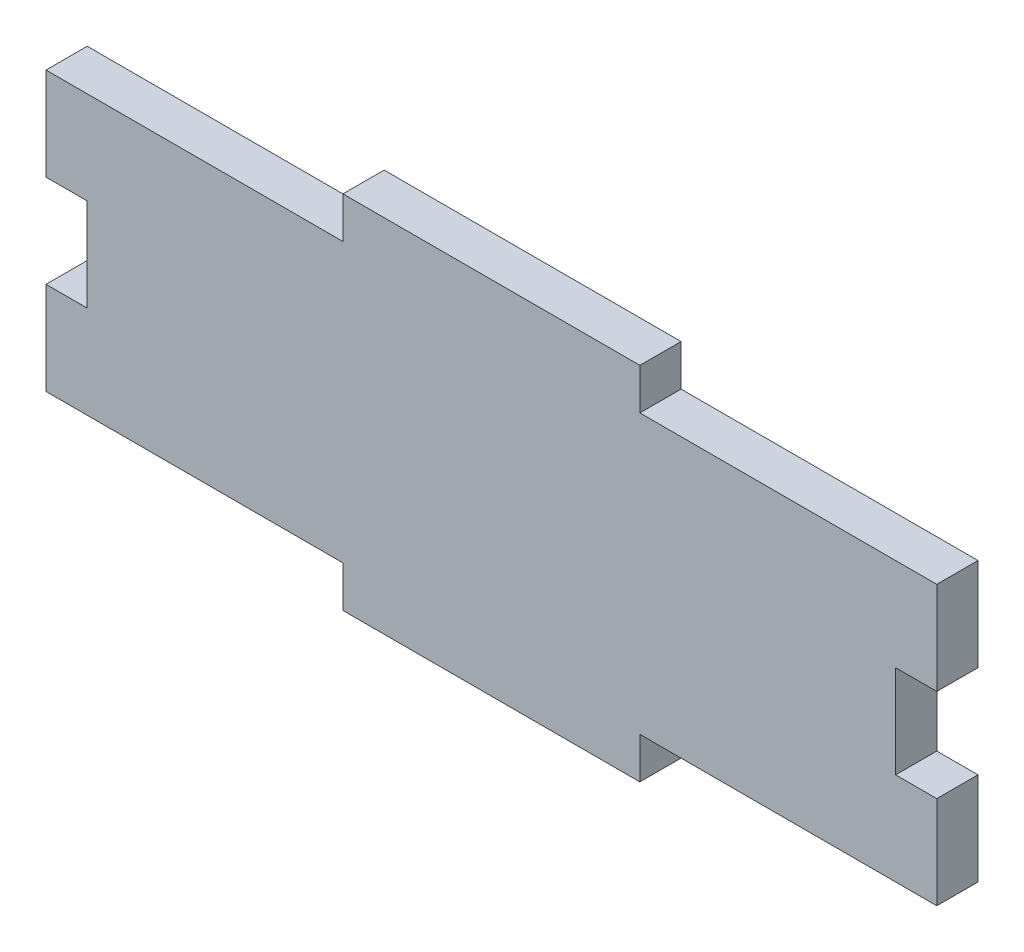
from build123d import *

# Parameters (mm, degrees)
BOSS_EXTRUDE1_DEPTH = 4.699
CAVITY1_START       = 10.583333333
CAVITY1_OUTLINE_W   = 4.699
CAVITY1_OUTLINE_H   = 4.699
CAVITY1_DEPTH       = 10.583333334


# Read off the part's stored shape, not the designer's step: Cavity1
with BuildPart() as part:
    # Sketch1 → Boss-Extrude1 (new body)
    with BuildSketch(Plane.XY):
        Polygon((67.733333333, 31.75), (101.6, 31.75), (101.6, 0), (67.733333333, 0), (67.733333333, -4.699), (33.866666667, -4.699), (33.866666667, 0), (0, 0), (0, 31.75), (33.866666667, 31.75), (33.866666667, 36.449), (67.733333333, 36.449), align=None)
    extrude(amount=BOSS_EXTRUDE1_DEPTH)

    # Cavity1 outline → Cavity1 (cut)
    with BuildSketch(Plane(origin=(0, 0, 0), x_dir=(1, 0, 0), z_dir=(0, 1, 0)).offset(CAVITY1_START)):
        with Locations((2.3495, -2.3495)):
            Rectangle(CAVITY1_OUTLINE_W, CAVITY1_OUTLINE_H)
        with Locations((99.2505, -2.3495)):
            Rectangle(CAVITY1_OUTLINE_W, CAVITY1_OUTLINE_H)
    extrude(amount=CAVITY1_DEPTH, mode=Mode.SUBTRACT)


solid = part.part
